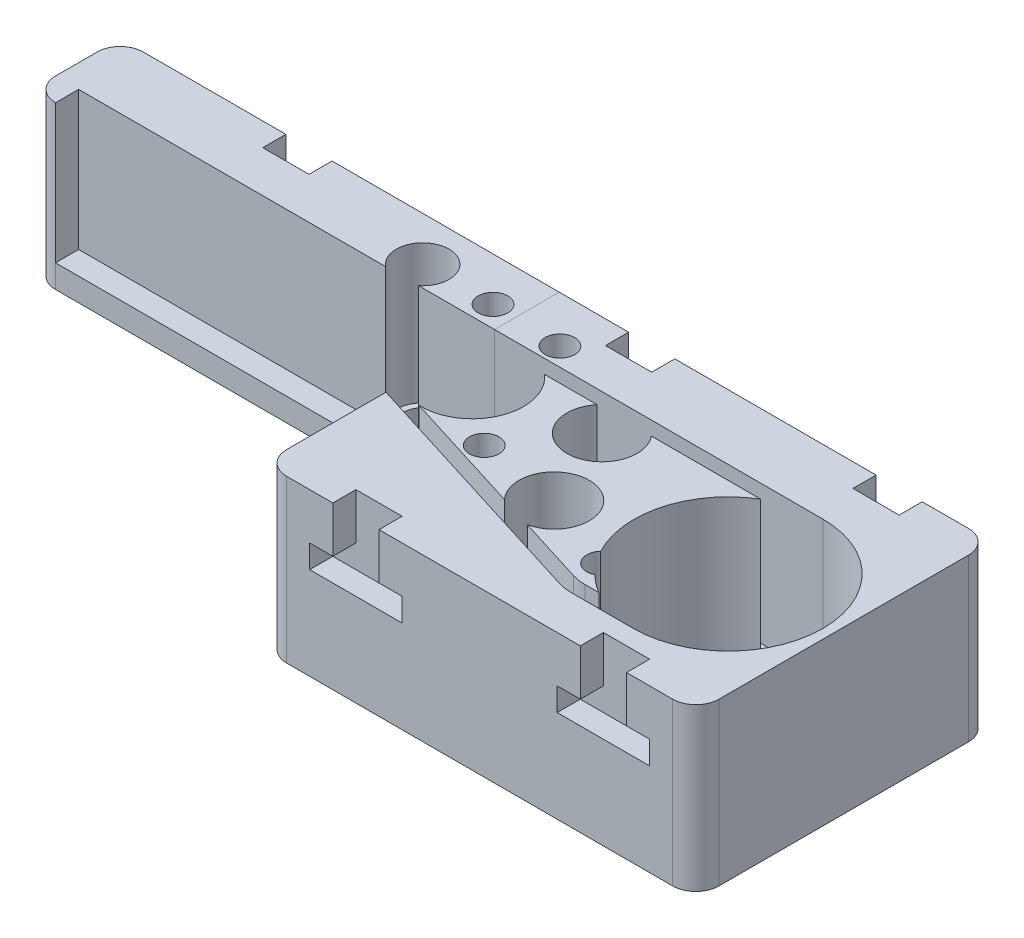
from build123d import *

# Parameters (mm, degrees)
SKETCH1_W               = 93.55
SKETCH1_H               = 60
BOSS_EXTRUDE1_DEPTH     = 35
CUT_EXTRUDE1_DEPTH      = 30
FILLET1_R               = 10
SKETCH3_R               = 20.4
SKETCH3_R_2             = 7.6
SKETCH3_R_3             = 11.1
CUT_EXTRUDE2_DEPTH      = 30
CUT_EXTRUDE3_DEPTH      = 30
SKETCH7_R               = 4.35
CUT_EXTRUDE4_DEPTH      = 84.815273071
SKETCH8_W               = 10
SKETCH8_H               = 10
SKETCH8_W_2             = 20
SKETCH8_H_2             = 5
CUT_EXTRUDE5_DEPTH      = 5
SKETCH11_W              = 35
SKETCH11_H              = 10
BOSS_EXTRUDE2_DEPTH     = 95
BOSS_EXTRUDE3_DEPTH     = 5
SKETCH14_W              = 2
SKETCH14_H              = 30
CUT_EXTRUDE7_DEPTH      = 4.45
SKETCH21_W              = 188.55
SKETCH21_H              = 35
BOSS_EXTRUDE4_DEPTH     = 4
CUT_REVOLVE_THIN1_START = 5
CUT_REVOLVE_THIN1_DEPTH = 30
SKETCH18_R              = 4.372505649
CUT_EXTRUDE8_DEPTH      = 130.61520937
CUT_EXTRUDE9_DEPTH      = 5
SKETCH10_W              = 20
SKETCH10_H              = 5
SKETCH10_W_2            = 10
SKETCH10_H_2            = 10
CUT_EXTRUDE6_DEPTH      = 5
FILLET2_R               = 5
SKETCH23_R              = 3.075
CUT_EXTRUDE10_DEPTH     = 130.61520937
SKETCH24_R              = 3.2
CUT_EXTRUDE11_DEPTH     = 31.5
SPLIT1_SURFACE_1_BACK   = 203.169
SPLIT1_SURFACE_1_DEPTH  = 406.338
SPLIT1_SURFACE_2_BACK   = 203.169
SPLIT1_SURFACE_2_DEPTH  = 406.338


# Read off the part's stored shape, not the designer's step: Cut-Revolve-Thin1
with BuildPart() as part:
    # Sketch1 → Boss-Extrude1 (new body)
    with BuildSketch(Plane(origin=(0, 0, 0), x_dir=(-1, 0, 0), z_dir=(0, 1, 0))):
        with Locations((-23.225, -5)):
            Rectangle(SKETCH1_W, SKETCH1_H)
    extrude(amount=BOSS_EXTRUDE1_DEPTH)

    # Sketch2 → Cut-Extrude1 (cut)
    with BuildSketch(Plane(origin=(0, 35, 0), x_dir=(-1, 0, 0), z_dir=(0, 1, 0))):
        with BuildLine():
            Line((23.55, -22), (-47.5, -22))
            ThreePointArc((-47.5, -22), (-65, -4.5), (-47.5, 13))
            Line((-47.5, 13), (-32.5, 13))
            Line((-32.5, 13), (23.55, -4.498536585))
            Line((23.55, -4.498536585), (23.55, -1.498536585))
            Line((23.55, -1.498536585), (-32.5, 16))
            Line((-32.5, 16), (-47.5, 16))
            ThreePointArc((-47.5, 16), (-68, -4.5), (-47.5, -25))
            Line((-47.5, -25), (23.55, -25))
            Line((23.55, -25), (23.55, -22))
        make_face()
    extrude(amount=-CUT_EXTRUDE1_DEPTH, mode=Mode.SUBTRACT)

    # Fillet1
    fillet1_edges = [part.edges().sort_by_distance(p)[0] for p in [
        (32.5, 20, 16),
        (32.5, 20, 13),
    ]]
    fillet(fillet1_edges, radius=FILLET1_R)

    # Sketch3 → Cut-Extrude2 (cut)
    with BuildSketch(Plane(origin=(0, 35, 0), x_dir=(-1, 0, 0), z_dir=(0, 1, 0))):
        with Locations((-47.5, -4.5)):
            Circle(SKETCH3_R)
        with Locations((-7.5, -17.2)):
            Circle(SKETCH3_R_2)
        with Locations((-14.943111192, 0.602558917)):
            Circle(SKETCH3_R_2)
        with Locations((17.072475727, -13.7)):
            Circle(SKETCH3_R_3)
    extrude(amount=-CUT_EXTRUDE2_DEPTH, mode=Mode.SUBTRACT)

    # Sketch4 → Cut-Extrude3 (cut)
    with BuildSketch(Plane(origin=(0, 35, 0), x_dir=(-1, 0, 0), z_dir=(0, 1, 0))):
        Polygon((23.036100787, -4.338099758), (23.55, -4.686028662), (23.55, -4.498536585), align=None)
    extrude(amount=-CUT_EXTRUDE3_DEPTH, mode=Mode.SUBTRACT)

    # Sketch7 → Cut-Extrude4 (cut, through all)
    with BuildSketch(Plane(origin=(0, 5, 0), x_dir=(-1, 0, 0), z_dir=(0, 1, 0))):
        with Locations(Location((-47.5, -4.5, 0), (0, 0, 90))):
            Circle(SKETCH7_R)
        with Locations(Location((-14.943111192, 0.602558917, 0), (0, 0, 90))):
            Circle(SKETCH7_R)
        with Locations(Location((-7.5, -17.2, 0), (0, 0, 90))):
            Circle(SKETCH7_R)
        with Locations(Location((17.072475727, -13.7, 0), (0, 0, 90))):
            Circle(SKETCH7_R)
    extrude(amount=-CUT_EXTRUDE4_DEPTH, mode=Mode.SUBTRACT)

    # Sketch8 → Cut-Extrude5 (cut)
    with BuildSketch(Plane.XY.offset(25)):
        with Locations((50, 30)):
            Rectangle(SKETCH8_W, SKETCH8_H)
        with Locations((50, 22.5)):
            Rectangle(SKETCH8_W_2, SKETCH8_H_2)
        with Locations((-3.55, 22.5)):
            Rectangle(SKETCH8_W_2, SKETCH8_H_2)
        with Locations((-3.55, 30)):
            Rectangle(SKETCH8_W, SKETCH8_H)
    extrude(amount=-CUT_EXTRUDE5_DEPTH, mode=Mode.SUBTRACT)

    # Sketch11 → Boss-Extrude2 (add)
    with BuildSketch(Plane(origin=(-23.55, 0, 0), x_dir=(0, -1, 0), z_dir=(-1, 0, 0))):
        with Locations((-17.5, -30)):
            Rectangle(SKETCH11_W, SKETCH11_H)
    extrude(amount=BOSS_EXTRUDE2_DEPTH)

    # Sketch12 → Boss-Extrude3 (add)
    with BuildSketch(Plane.XY.offset(-25)):
        Polygon((-113.55, 35), (-113.55, 5), (-23.55, 5), (-23.55, 0), (-118.55, 0), (-118.55, 35), align=None)
    extrude(amount=BOSS_EXTRUDE3_DEPTH)

    # Sketch14 → Cut-Extrude7 (cut)
    with BuildSketch(Plane.XY.offset(-25)):
        with Locations((-43.55, 20)):
            Rectangle(SKETCH14_W, SKETCH14_H)
    extrude(amount=-CUT_EXTRUDE7_DEPTH, mode=Mode.SUBTRACT)

    # Sketch21 → Boss-Extrude4 (add)
    with BuildSketch(Plane(origin=(0, 0, -35), x_dir=(1, 0, 0), z_dir=(0, 0, -1))):
        with Locations((-24.275, -17.5)):
            Rectangle(SKETCH21_W, SKETCH21_H)
    extrude(amount=BOSS_EXTRUDE4_DEPTH)

    # Cut-Revolve-Thin1 outline → Cut-Revolve-Thin1 (cut)
    with BuildSketch(Plane(origin=(0, 0, 0), x_dir=(1, 0, 0), z_dir=(0, 1, 0)).offset(CUT_REVOLVE_THIN1_START)):
        with BuildLine():
            ThreePointArc((-39.988048288, 25), (-43.55, 35.15), (-47.111951712, 25))
            Line((-47.111951712, 25), (-44.55, 25))
            Line((-44.55, 25), (-44.55, 29.45))
            Line((-44.55, 29.45), (-42.55, 29.45))
            Line((-42.55, 29.45), (-42.55, 25))
            Line((-42.55, 25), (-39.988048288, 25))
        make_face()
    extrude(amount=CUT_REVOLVE_THIN1_DEPTH, mode=Mode.SUBTRACT)

    # Sketch18 → Cut-Extrude8 (cut, through all)
    with BuildSketch(Plane.XZ):
        with Locations(Location((-43.55, -29.5, 0), (0, 0, 270))):
            Circle(SKETCH18_R)
    extrude(amount=-CUT_EXTRUDE8_DEPTH, mode=Mode.SUBTRACT)

    # Sketch19 → Cut-Extrude9 (cut)
    with BuildSketch(Plane(origin=(0, 0, -39), x_dir=(1, 0, 0), z_dir=(0, 0, -1))):
        Polygon((-87.704165959, -25), (-87.704165959, -20), (-67.704165959, -20), (-67.704165959, -25), (-72.704165959, -25), (-72.704165959, -35), (-82.704165959, -35), (-82.704165959, -25), align=None)
    extrude(amount=-CUT_EXTRUDE9_DEPTH, mode=Mode.SUBTRACT)

    # Sketch10 → Cut-Extrude6 (cut)
    with BuildSketch(Plane(origin=(0, 0, -39), x_dir=(-1, 0, 0), z_dir=(0, 0, -1))):
        with Locations((3.55, 22.5)):
            Rectangle(SKETCH10_W, SKETCH10_H)
        Polygon((-45, 25), (-55, 25), (-60, 25), (-60, 20), (-40, 20), (-40, 25), align=None)
        with Locations((-50, 30)):
            Rectangle(SKETCH10_W_2, SKETCH10_H_2)
        with Locations((3.55, 30)):
            Rectangle(SKETCH10_W_2, SKETCH10_H_2)
    extrude(amount=-CUT_EXTRUDE6_DEPTH, mode=Mode.SUBTRACT)

    # Fillet2
    fillet2_edges = [part.edges().sort_by_distance(p)[0] for p in [
        (-118.55, 17.5, -20),
        (-118.55, 17.5, -39),
        (70, 17.5, -39),
        (-23.55, 17.5, 25),
        (70, 17.5, 25),
    ]]
    fillet(fillet2_edges, radius=FILLET2_R)

    # Sketch23 → Cut-Extrude10 (cut, through all)
    with BuildSketch(Plane.XZ):
        with Locations(Location((-2.9636134, -2.17630607, 0), (0, 0, 270))):
            Circle(SKETCH23_R)
        with Locations(Location((31.83967628, 7.23022785, 0), (0, 0, 270))):
            Circle(SKETCH23_R)
        with Locations(Location((-13.37707505, -28.96832789, 0), (0, 0, 270))):
            Circle(SKETCH23_R)
        with Locations(Location((-28.42344593, -29.5373241, 0), (0, 0, 270))):
            Circle(SKETCH23_R)
    extrude(amount=-CUT_EXTRUDE10_DEPTH, mode=Mode.SUBTRACT)

    # Sketch24 → Cut-Extrude11 (cut)
    with BuildSketch(Plane(origin=(0, 35, 0), x_dir=(-1, 0, 0), z_dir=(0, 1, 0))):
        with Locations(Location((-31.83967628, 7.23022785, 0), (0, 0, 90))):
            Circle(SKETCH24_R)
        with Locations(Location((2.9636134, -2.17630607, 0), (0, 0, 90))):
            Circle(SKETCH24_R)
        with Locations(Location((13.37707505, -28.96832789, 0), (0, 0, 90))):
            Circle(SKETCH24_R)
        with Locations(Location((28.42344593, -29.5373241, 0), (0, 0, 90))):
            Circle(SKETCH24_R)
    extrude(amount=-CUT_EXTRUDE11_DEPTH, mode=Mode.SUBTRACT)


with BuildPart() as body_2:
    # Split1: the piece behind the surface
    add(part.part)
    # Split1 surface: a surface, the sketch's curves swept straight by 406.338 mm
    with BuildLine(Plane(origin=(0, 0, 0), x_dir=(-1, 0, 0), z_dir=(0, -1, 0)).offset(-SPLIT1_SURFACE_1_BACK), mode=Mode.PRIVATE) as split1_surface_1_path:
        Line((23.55, 20), (23.55, 39))
    split1_surface_1 = Shell.extrude(split1_surface_1_path.wire(), (0 * SPLIT1_SURFACE_1_DEPTH, -1 * SPLIT1_SURFACE_1_DEPTH, 0 * SPLIT1_SURFACE_1_DEPTH))
    split(bisect_by=split1_surface_1, keep=Keep.BOTTOM)


with BuildPart() as part_1:
    add(part.part)

    # Split1: split by a surface, the side it looks to stays
    # Split1 surface: a surface, the sketch's curves swept straight by 406.338 mm
    with BuildLine(Plane(origin=(0, 0, 0), x_dir=(-1, 0, 0), z_dir=(0, -1, 0)).offset(-SPLIT1_SURFACE_2_BACK), mode=Mode.PRIVATE) as split1_surface_2_path:
        Line((23.55, 20), (23.55, 39))
    split1_surface_2 = Shell.extrude(split1_surface_2_path.wire(), (0 * SPLIT1_SURFACE_2_DEPTH, -1 * SPLIT1_SURFACE_2_DEPTH, 0 * SPLIT1_SURFACE_2_DEPTH))
    split(bisect_by=split1_surface_2, keep=Keep.TOP)


solid = Compound([body_2.part, part_1.part])
